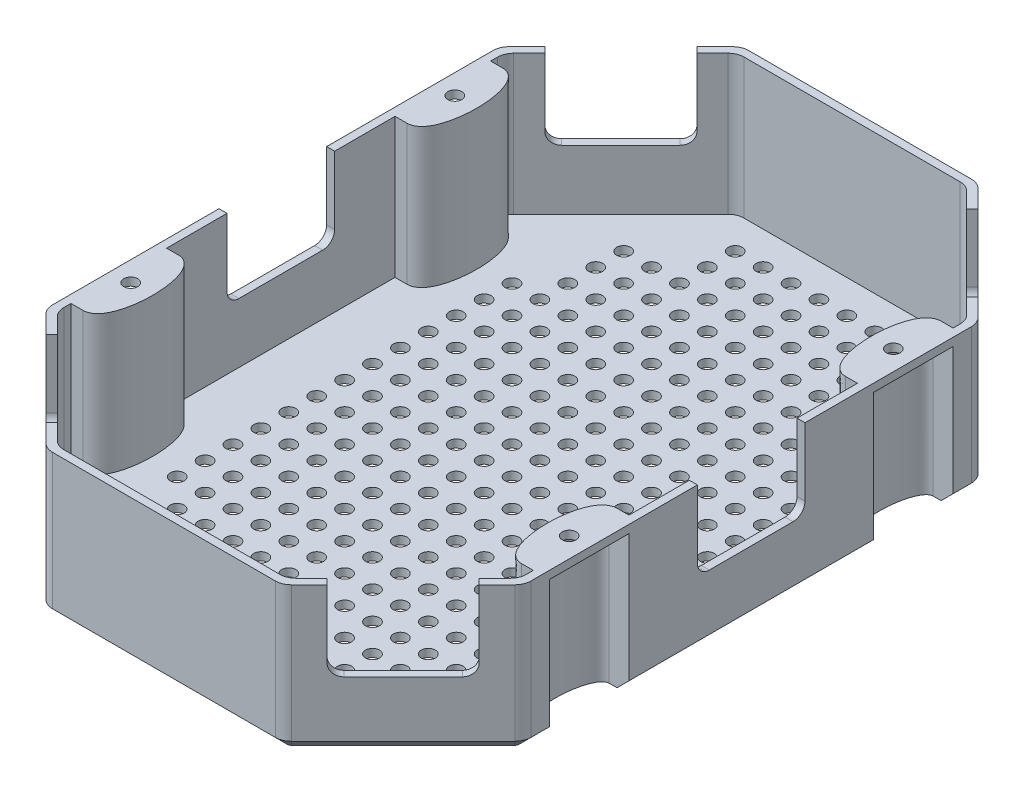
from build123d import *

# Parameters (mm, degrees)
BOSS_EXTRUDE1_DEPTH     = 2
BOSS_EXTRUDE2_DEPTH     = 35
BOSS_EXTRUDE3_DEPTH     = 2
SKETCH4_R               = 1.75
CUT_EXTRUDE1_DEPTH      = 112.570767392
SKETCH5_W               = 2
SKETCH5_H               = 27
CUT_EXTRUDE2_DEPTH      = 20
FILLET1_R               = 3
FILLET2_R               = 4
CHAMFER1_SIZE           = 3
FILL_PATTERN1_OUTLINE_R = 1.75
FILL_PATTERN1_DEPTH     = 2


# Read off the part's stored shape, not the designer's step: Fill Pattern1
with BuildPart() as part:
    # Sketch1 → Boss-Extrude1 (new body)
    with BuildSketch(Plane(origin=(0, 0, 0), x_dir=(1, 0, 0), z_dir=(0, 1, 0))):
        with BuildLine():
            Line((55, 30.651951673), (60, 30.651951673))
            Line((60, 30.651951673), (60, -30.651951673))
            Line((60, -30.651951673), (55, -30.651951673))
            add(Edge.make_bspline(
                [(55, -30.651951673), (51.5, -30.651951673), (51.5, -40.651951673), (51.5, -50.651951673), (55, -50.651951673)],
                knots=[3.141592654, 3.141592654, 3.141592654, 4.71238898, 4.71238898, 6.283185307, 6.283185307, 6.283185307], degree=2, weights=[1, 0.707106781, 1, 0.707106781, 1]))
            Line((55, -50.651951673), (60, -50.651951673))
            Line((60, -50.651951673), (60, -56.904408409))
            Line((60, -56.904408409), (29.594408409, -87.31))
            Line((29.594408409, -87.31), (0, -87.31))
            Line((0, -87.31), (0, 87.31))
            Line((0, 87.31), (29.594408409, 87.31))
            Line((29.594408409, 87.31), (60, 56.904408409))
            Line((60, 56.904408409), (60, 50.651951673))
            Line((60, 50.651951673), (55, 50.651951673))
            add(Edge.make_bspline(
                [(55, 50.651951673), (51.5, 50.651951673), (51.5, 40.651951673), (51.5, 30.651951673), (55, 30.651951673)],
                knots=[0, 0, 0, 1.570796327, 1.570796327, 3.141592654, 3.141592654, 3.141592654], degree=2, weights=[1, 0.707106781, 1, 0.707106781, 1]))
        make_face()
    extrude(amount=BOSS_EXTRUDE1_DEPTH)

    # Sketch2 → Boss-Extrude2 (add)
    with BuildSketch(Plane(origin=(0, 2, 0), x_dir=(1, 0, 0), z_dir=(0, 1, 0))):
        with BuildLine():
            Line((29.594408409, 87.31), (0, 87.31))
            Line((0, 87.31), (0, 85.31))
            Line((0, 85.31), (28.765981284, 85.31))
            Line((28.765981284, 85.31), (58, 56.075981284))
            Line((58, 56.075981284), (58, 52.651951673))
            Line((58, 52.651951673), (55, 52.651951673))
            add(Edge.make_bspline(
                [(55, 28.651951673), (54.70222525, 28.651951673), (54.094873807, 28.739043927), (53.042573201, 29.199915612), (52.077202892, 30.084886092), (51.253226578, 31.371465347), (50.612948374, 32.884681085), (50.119437244, 34.610908381), (49.645142322, 37.151780185), (49.403238452, 40.651951673), (49.645142322, 44.152123161), (50.119437244, 46.692994964), (50.612948374, 48.419222261), (51.253226578, 49.932437998), (52.077202892, 51.219017254), (53.042573201, 52.103987733), (54.094873807, 52.564859419), (54.70222525, 52.651951673), (55, 52.651951673)],
                knots=[0, 0, 0, 0, 0.09817477, 0.196349541, 0.392699082, 0.589048623, 0.785398163, 0.981747704, 1.178097245, 1.570796327, 1.963495408, 2.159844949, 2.35619449, 2.552544031, 2.748893572, 2.945243113, 3.043417883, 3.141592654, 3.141592654, 3.141592654, 3.141592654], degree=3))
            Line((55, 28.651951673), (58, 28.651951673))
            Line((58, 28.651951673), (58, -28.651951673))
            Line((58, -28.651951673), (55, -28.651951673))
            add(Edge.make_bspline(
                [(55, -52.651951673), (54.70222525, -52.651951673), (54.094873807, -52.564859419), (53.042573201, -52.103987733), (52.077202892, -51.219017254), (51.253226578, -49.932437998), (50.612948374, -48.419222261), (50.119437244, -46.692994964), (49.645142322, -44.152123161), (49.403238452, -40.651951673), (49.645142322, -37.151780185), (50.119437244, -34.610908381), (50.612948374, -32.884681085), (51.253226578, -31.371465347), (52.077202892, -30.084886092), (53.042573201, -29.199915612), (54.094873807, -28.739043927), (54.70222525, -28.651951673), (55, -28.651951673)],
                knots=[3.141592654, 3.141592654, 3.141592654, 3.141592654, 3.239767424, 3.337942194, 3.534291735, 3.730641276, 3.926990817, 4.123340358, 4.319689899, 4.71238898, 5.105088062, 5.301437603, 5.497787144, 5.694136685, 5.890486225, 6.086835766, 6.185010537, 6.283185307, 6.283185307, 6.283185307, 6.283185307], degree=3))
            Line((55, -52.651951673), (58, -52.651951673))
            Line((58, -52.651951673), (58, -56.075981284))
            Line((58, -56.075981284), (28.765981284, -85.31))
            Line((28.765981284, -85.31), (0, -85.31))
            Line((0, -85.31), (0, -87.31))
            Line((0, -87.31), (29.594408409, -87.31))
            Line((29.594408409, -87.31), (60, -56.904408409))
            Line((60, -56.904408409), (60, -50.651951673))
            Line((60, -50.651951673), (55, -50.651951673))
            add(Edge.make_bspline(
                [(55, -30.651951673), (51.5, -30.651951673), (51.5, -40.651951673), (51.5, -50.651951673), (55, -50.651951673)],
                knots=[3.141592654, 3.141592654, 3.141592654, 4.71238898, 4.71238898, 6.283185307, 6.283185307, 6.283185307], degree=2, weights=[1, 0.707106781, 1, 0.707106781, 1]))
            Line((55, -30.651951673), (60, -30.651951673))
            Line((60, -30.651951673), (60, 30.651951673))
            Line((60, 30.651951673), (55, 30.651951673))
            add(Edge.make_bspline(
                [(55, 50.651951673), (51.5, 50.651951673), (51.5, 40.651951673), (51.5, 30.651951673), (55, 30.651951673)],
                knots=[0, 0, 0, 1.570796327, 1.570796327, 3.141592654, 3.141592654, 3.141592654], degree=2, weights=[1, 0.707106781, 1, 0.707106781, 1]))
            Line((55, 50.651951673), (60, 50.651951673))
            Line((60, 50.651951673), (60, 56.904408409))
            Line((60, 56.904408409), (29.594408409, 87.31))
        make_face()
    extrude(amount=BOSS_EXTRUDE2_DEPTH)

    # Sketch3 → Boss-Extrude3 (add)
    with BuildSketch(Plane(origin=(0, 37, 0), x_dir=(1, 0, 0), z_dir=(0, 1, 0))):
        with BuildLine():
            Line((60, 30.651951673), (55, 30.651951673))
            add(Edge.make_bspline(
                [(55, 50.651951673), (51.5, 50.651951673), (51.5, 40.651951673), (51.5, 30.651951673), (55, 30.651951673)],
                knots=[0, 0, 0, 1.570796327, 1.570796327, 3.141592654, 3.141592654, 3.141592654], degree=2, weights=[1, 0.707106781, 1, 0.707106781, 1]))
            Line((55, 50.651951673), (60, 50.651951673))
            Line((60, 50.651951673), (60, 30.651951673))
        make_face()
        with BuildLine():
            Line((55, -50.651951673), (60, -50.651951673))
            Line((60, -50.651951673), (60, -30.651951673))
            Line((60, -30.651951673), (55, -30.651951673))
            add(Edge.make_bspline(
                [(55, -30.651951673), (51.5, -30.651951673), (51.5, -40.651951673), (51.5, -50.651951673), (55, -50.651951673)],
                knots=[3.141592654, 3.141592654, 3.141592654, 4.71238898, 4.71238898, 6.283185307, 6.283185307, 6.283185307], degree=2, weights=[1, 0.707106781, 1, 0.707106781, 1]))
        make_face()
    extrude(amount=-BOSS_EXTRUDE3_DEPTH)

    # Sketch4 → Cut-Extrude1 (cut, through all)
    with BuildSketch(Plane.XZ.offset(-35)):
        with Locations(Location((55, 40.651951673, 0), (0, 0, 270))):
            Circle(SKETCH4_R)
        with Locations(Location((55, -40.651951673, 0), (0, 0, 90))):
            Circle(SKETCH4_R)
    extrude(amount=-CUT_EXTRUDE1_DEPTH, mode=Mode.SUBTRACT)

    # Sketch5 → Cut-Extrude2 (cut)
    with BuildSketch(Plane(origin=(0, 37, 0), x_dir=(1, 0, 0), z_dir=(0, 1, 0))):
        with Locations((59, 0)):
            Rectangle(SKETCH5_W, SKETCH5_H)
        Polygon((33.837049096, 80.238932188), (52.928932188, 61.147049096), (54.343145751, 62.561262658), (35.251262658, 81.653145751), align=None)
        Polygon((54.343145751, -62.561262658), (35.251262658, -81.653145751), (33.837049096, -80.238932188), (52.928932188, -61.147049096), align=None)
    extrude(amount=-CUT_EXTRUDE2_DEPTH, mode=Mode.SUBTRACT)

    # Fillet1
    fillet1_edges = [part.edges().sort_by_distance(p)[0] for p in [
        (59, 17, -13.5),
        (59, 17, 13.5),
        (53.636038969, 17, -61.854155877),
        (34.544155877, 17, -80.946038969),
        (53.636038969, 17, 61.854155877),
        (34.544155877, 17, 80.946038969),
    ]]
    fillet(fillet1_edges, radius=FILLET1_R)

    # Fillet2
    fillet2_edges = [part.edges().sort_by_distance(p)[0] for p in [
        (60, 18.5, 56.904408409),
        (29.594408409, 18.5, 87.31),
        (29.594408409, 18.5, -87.31),
        (60, 18.5, -56.904408409),
        (28.765981284, 19.5, -85.31),
        (58, 19.5, -56.075981284),
        (58, 19.5, 56.075981284),
        (28.765981284, 19.5, 85.31),
    ]]
    fillet(fillet2_edges, radius=FILLET2_R)

    # Chamfer1
    chamfer1_edges = [part.edges().sort_by_distance(p)[0] for p in [
        (60, 0, 0),
        (13.96877708, 0, 87.31),
        (60, 0, -52.949752916),
        (13.96877708, 0, -87.31),
        (60, 0, 52.949752916),
        (44.797204204, 0, 72.107204204),
        (44.797204204, 0, -72.107204204),
        (29.468287889, 0, 87.00551813),
        (59.69551813, 0, 56.778287889),
        (59.69551813, 0, -56.778287889),
        (29.468287889, 0, -87.00551813),
    ]]
    chamfer(chamfer1_edges, length=CHAMFER1_SIZE)

    # Mirror1: part across plane


with BuildPart() as part_1:
    add(part.part)
    add(part.part.mirror(Plane(origin=(0, 0, 0), x_dir=(0, 0, 1), z_dir=(1, 0, 0))))

    # Fill Pattern1 outline → Fill Pattern1 (cut)
    with BuildSketch(Plane(origin=(0, 0, 0), x_dir=(1, 0, 0), z_dir=(0, 1, 0))):
        Circle(FILL_PATTERN1_OUTLINE_R)
        with Locations((21, -77)):
            Circle(FILL_PATTERN1_OUTLINE_R)
        with Locations((14, -77)):
            Circle(FILL_PATTERN1_OUTLINE_R)
        with Locations((7, -77)):
            Circle(FILL_PATTERN1_OUTLINE_R)
        with Locations((0, -77)):
            Circle(FILL_PATTERN1_OUTLINE_R)
        with Locations((-7, -77)):
            Circle(FILL_PATTERN1_OUTLINE_R)
        with Locations((-14, -77)):
            Circle(FILL_PATTERN1_OUTLINE_R)
        with Locations((-7, 56)):
            Circle(FILL_PATTERN1_OUTLINE_R)
        with Locations((0, 63)):
            Circle(FILL_PATTERN1_OUTLINE_R)
        with Locations((7, 70)):
            Circle(FILL_PATTERN1_OUTLINE_R)
        with Locations((14, 77)):
            Circle(FILL_PATTERN1_OUTLINE_R)
        with Locations((0, -14)):
            Circle(FILL_PATTERN1_OUTLINE_R)
        with Locations((-21, -7)):
            Circle(FILL_PATTERN1_OUTLINE_R)
        with Locations((-28, 14)):
            Circle(FILL_PATTERN1_OUTLINE_R)
        with Locations((-35, 35)):
            Circle(FILL_PATTERN1_OUTLINE_R)
        with Locations((-21, -14)):
            Circle(FILL_PATTERN1_OUTLINE_R)
        with Locations((7, -14)):
            Circle(FILL_PATTERN1_OUTLINE_R)
        with Locations((7, 77)):
            Circle(FILL_PATTERN1_OUTLINE_R)
        with Locations((0, 70)):
            Circle(FILL_PATTERN1_OUTLINE_R)
        with Locations((-7, 63)):
            Circle(FILL_PATTERN1_OUTLINE_R)
        with Locations((-14, 56)):
            Circle(FILL_PATTERN1_OUTLINE_R)
        with Locations((-21, 49)):
            Circle(FILL_PATTERN1_OUTLINE_R)
        with Locations((-28, 42)):
            Circle(FILL_PATTERN1_OUTLINE_R)
        with Locations((-14, -14)):
            Circle(FILL_PATTERN1_OUTLINE_R)
        with Locations((-21, 7)):
            Circle(FILL_PATTERN1_OUTLINE_R)
        with Locations((-28, 28)):
            Circle(FILL_PATTERN1_OUTLINE_R)
        with Locations((-21, 35)):
            Circle(FILL_PATTERN1_OUTLINE_R)
        with Locations((-14, 42)):
            Circle(FILL_PATTERN1_OUTLINE_R)
        with Locations((-7, 49)):
            Circle(FILL_PATTERN1_OUTLINE_R)
        with Locations((0, 56)):
            Circle(FILL_PATTERN1_OUTLINE_R)
        with Locations((7, 63)):
            Circle(FILL_PATTERN1_OUTLINE_R)
        with Locations((-14, 49)):
            Circle(FILL_PATTERN1_OUTLINE_R)
        with Locations((-21, 42)):
            Circle(FILL_PATTERN1_OUTLINE_R)
        with Locations((-28, 35)):
            Circle(FILL_PATTERN1_OUTLINE_R)
        with Locations((-28, 21)):
            Circle(FILL_PATTERN1_OUTLINE_R)
        with Locations((-21, 0)):
            Circle(FILL_PATTERN1_OUTLINE_R)
        with Locations((-7, -14)):
            Circle(FILL_PATTERN1_OUTLINE_R)
        with Locations((21, 77)):
            Circle(FILL_PATTERN1_OUTLINE_R)
        with Locations((14, 70)):
            Circle(FILL_PATTERN1_OUTLINE_R)
        with Locations((-14, 70)):
            Circle(FILL_PATTERN1_OUTLINE_R)
        with Locations((-7, 77)):
            Circle(FILL_PATTERN1_OUTLINE_R)
        with Locations((14, -7)):
            Circle(FILL_PATTERN1_OUTLINE_R)
        with Locations((-14, -21)):
            Circle(FILL_PATTERN1_OUTLINE_R)
        with Locations((-28, -7)):
            Circle(FILL_PATTERN1_OUTLINE_R)
        with Locations((-35, 14)):
            Circle(FILL_PATTERN1_OUTLINE_R)
        with Locations((-42, 35)):
            Circle(FILL_PATTERN1_OUTLINE_R)
        with Locations((-35, 56)):
            Circle(FILL_PATTERN1_OUTLINE_R)
        with Locations((-42, 28)):
            Circle(FILL_PATTERN1_OUTLINE_R)
        with Locations((-35, 7)):
            Circle(FILL_PATTERN1_OUTLINE_R)
        with Locations((-28, -14)):
            Circle(FILL_PATTERN1_OUTLINE_R)
        with Locations((-7, -21)):
            Circle(FILL_PATTERN1_OUTLINE_R)
        with Locations((14, 0)):
            Circle(FILL_PATTERN1_OUTLINE_R)
        with Locations((-14, 77)):
            Circle(FILL_PATTERN1_OUTLINE_R)
        with Locations((-21, 70)):
            Circle(FILL_PATTERN1_OUTLINE_R)
        with Locations((-28, 63)):
            Circle(FILL_PATTERN1_OUTLINE_R)
        with Locations((-28, 7)):
            Circle(FILL_PATTERN1_OUTLINE_R)
        with Locations((-35, 28)):
            Circle(FILL_PATTERN1_OUTLINE_R)
        with Locations((-35, 42)):
            Circle(FILL_PATTERN1_OUTLINE_R)
        with Locations((-28, 49)):
            Circle(FILL_PATTERN1_OUTLINE_R)
        with Locations((-21, 56)):
            Circle(FILL_PATTERN1_OUTLINE_R)
        with Locations((-14, 63)):
            Circle(FILL_PATTERN1_OUTLINE_R)
        with Locations((-7, 70)):
            Circle(FILL_PATTERN1_OUTLINE_R)
        with Locations((0, 77)):
            Circle(FILL_PATTERN1_OUTLINE_R)
        with Locations((14, -14)):
            Circle(FILL_PATTERN1_OUTLINE_R)
        with Locations((-21, -21)):
            Circle(FILL_PATTERN1_OUTLINE_R)
        with Locations((-28, 0)):
            Circle(FILL_PATTERN1_OUTLINE_R)
        with Locations((-35, 21)):
            Circle(FILL_PATTERN1_OUTLINE_R)
        with Locations((-42, 42)):
            Circle(FILL_PATTERN1_OUTLINE_R)
        with Locations((-35, 49)):
            Circle(FILL_PATTERN1_OUTLINE_R)
        with Locations((-28, 56)):
            Circle(FILL_PATTERN1_OUTLINE_R)
        with Locations((-21, 63)):
            Circle(FILL_PATTERN1_OUTLINE_R)
        with Locations((14, 35)):
            Circle(FILL_PATTERN1_OUTLINE_R)
        with Locations((7, 28)):
            Circle(FILL_PATTERN1_OUTLINE_R)
        with Locations((0, 21)):
            Circle(FILL_PATTERN1_OUTLINE_R)
        with Locations((-7, 14)):
            Circle(FILL_PATTERN1_OUTLINE_R)
        with Locations((21, 35)):
            Circle(FILL_PATTERN1_OUTLINE_R)
        with Locations((28, 42)):
            Circle(FILL_PATTERN1_OUTLINE_R)
        with Locations((35, 49)):
            Circle(FILL_PATTERN1_OUTLINE_R)
        with Locations((-7, 0)):
            Circle(FILL_PATTERN1_OUTLINE_R)
        with Locations((7, 35)):
            Circle(FILL_PATTERN1_OUTLINE_R)
        with Locations((0, 28)):
            Circle(FILL_PATTERN1_OUTLINE_R)
        with Locations((-7, 21)):
            Circle(FILL_PATTERN1_OUTLINE_R)
        with Locations((-14, 14)):
            Circle(FILL_PATTERN1_OUTLINE_R)
        with Locations((21, 42)):
            Circle(FILL_PATTERN1_OUTLINE_R)
        with Locations((28, 49)):
            Circle(FILL_PATTERN1_OUTLINE_R)
        with Locations((35, 56)):
            Circle(FILL_PATTERN1_OUTLINE_R)
        with Locations((-7, -7)):
            Circle(FILL_PATTERN1_OUTLINE_R)
        with Locations((7, 14)):
            Circle(FILL_PATTERN1_OUTLINE_R)
        with Locations((0, 7)):
            Circle(FILL_PATTERN1_OUTLINE_R)
        with Locations((42, 42)):
            Circle(FILL_PATTERN1_OUTLINE_R)
        with Locations((35, 35)):
            Circle(FILL_PATTERN1_OUTLINE_R)
        with Locations((28, 28)):
            Circle(FILL_PATTERN1_OUTLINE_R)
        with Locations((21, 21)):
            Circle(FILL_PATTERN1_OUTLINE_R)
        with Locations((14, 14)):
            Circle(FILL_PATTERN1_OUTLINE_R)
        with Locations((7, 7)):
            Circle(FILL_PATTERN1_OUTLINE_R)
        with Locations((14, 28)):
            Circle(FILL_PATTERN1_OUTLINE_R)
        with Locations((7, 21)):
            Circle(FILL_PATTERN1_OUTLINE_R)
        with Locations((0, 14)):
            Circle(FILL_PATTERN1_OUTLINE_R)
        with Locations((-7, 7)):
            Circle(FILL_PATTERN1_OUTLINE_R)
        with Locations((35, 42)):
            Circle(FILL_PATTERN1_OUTLINE_R)
        with Locations((28, 35)):
            Circle(FILL_PATTERN1_OUTLINE_R)
        with Locations((21, 28)):
            Circle(FILL_PATTERN1_OUTLINE_R)
        with Locations((14, 21)):
            Circle(FILL_PATTERN1_OUTLINE_R)
        with Locations((-14, -7)):
            Circle(FILL_PATTERN1_OUTLINE_R)
        with Locations((7, 0)):
            Circle(FILL_PATTERN1_OUTLINE_R)
        with Locations((21, 63)):
            Circle(FILL_PATTERN1_OUTLINE_R)
        with Locations((14, 56)):
            Circle(FILL_PATTERN1_OUTLINE_R)
        with Locations((7, 49)):
            Circle(FILL_PATTERN1_OUTLINE_R)
        with Locations((0, 42)):
            Circle(FILL_PATTERN1_OUTLINE_R)
        with Locations((-7, 35)):
            Circle(FILL_PATTERN1_OUTLINE_R)
        with Locations((-14, 28)):
            Circle(FILL_PATTERN1_OUTLINE_R)
        with Locations((-21, 14)):
            Circle(FILL_PATTERN1_OUTLINE_R)
        with Locations((-21, 28)):
            Circle(FILL_PATTERN1_OUTLINE_R)
        with Locations((-14, 35)):
            Circle(FILL_PATTERN1_OUTLINE_R)
        with Locations((-7, 42)):
            Circle(FILL_PATTERN1_OUTLINE_R)
        with Locations((0, 49)):
            Circle(FILL_PATTERN1_OUTLINE_R)
        with Locations((7, 56)):
            Circle(FILL_PATTERN1_OUTLINE_R)
        with Locations((14, 63)):
            Circle(FILL_PATTERN1_OUTLINE_R)
        with Locations((21, 70)):
            Circle(FILL_PATTERN1_OUTLINE_R)
        with Locations((14, 42)):
            Circle(FILL_PATTERN1_OUTLINE_R)
        with Locations((21, 49)):
            Circle(FILL_PATTERN1_OUTLINE_R)
        with Locations((28, 56)):
            Circle(FILL_PATTERN1_OUTLINE_R)
        with Locations((35, 63)):
            Circle(FILL_PATTERN1_OUTLINE_R)
        with Locations((0, -7)):
            Circle(FILL_PATTERN1_OUTLINE_R)
        with Locations((-14, 7)):
            Circle(FILL_PATTERN1_OUTLINE_R)
        with Locations((-14, 21)):
            Circle(FILL_PATTERN1_OUTLINE_R)
        with Locations((-7, 28)):
            Circle(FILL_PATTERN1_OUTLINE_R)
        with Locations((-21, 21)):
            Circle(FILL_PATTERN1_OUTLINE_R)
        with Locations((-14, 0)):
            Circle(FILL_PATTERN1_OUTLINE_R)
        with Locations((7, -7)):
            Circle(FILL_PATTERN1_OUTLINE_R)
        with Locations((28, 63)):
            Circle(FILL_PATTERN1_OUTLINE_R)
        with Locations((21, 56)):
            Circle(FILL_PATTERN1_OUTLINE_R)
        with Locations((14, 49)):
            Circle(FILL_PATTERN1_OUTLINE_R)
        with Locations((7, 42)):
            Circle(FILL_PATTERN1_OUTLINE_R)
        with Locations((0, 35)):
            Circle(FILL_PATTERN1_OUTLINE_R)
        with Locations((42, -28)):
            Circle(FILL_PATTERN1_OUTLINE_R)
        with Locations((35, 21)):
            Circle(FILL_PATTERN1_OUTLINE_R)
        with Locations((-21, -56)):
            Circle(FILL_PATTERN1_OUTLINE_R)
        with Locations((14, -49)):
            Circle(FILL_PATTERN1_OUTLINE_R)
        with Locations((42, -35)):
            Circle(FILL_PATTERN1_OUTLINE_R)
        with Locations((35, 14)):
            Circle(FILL_PATTERN1_OUTLINE_R)
        with Locations((-28, -56)):
            Circle(FILL_PATTERN1_OUTLINE_R)
        with Locations((7, -49)):
            Circle(FILL_PATTERN1_OUTLINE_R)
        with Locations((35, -49)):
            Circle(FILL_PATTERN1_OUTLINE_R)
        with Locations((42, -14)):
            Circle(FILL_PATTERN1_OUTLINE_R)
        with Locations((-7, -56)):
            Circle(FILL_PATTERN1_OUTLINE_R)
        with Locations((28, -49)):
            Circle(FILL_PATTERN1_OUTLINE_R)
        with Locations((42, -21)):
            Circle(FILL_PATTERN1_OUTLINE_R)
        with Locations((35, 28)):
            Circle(FILL_PATTERN1_OUTLINE_R)
        with Locations((-14, -56)):
            Circle(FILL_PATTERN1_OUTLINE_R)
        with Locations((21, -49)):
            Circle(FILL_PATTERN1_OUTLINE_R)
        with Locations((35, -14)):
            Circle(FILL_PATTERN1_OUTLINE_R)
        with Locations((21, -42)):
            Circle(FILL_PATTERN1_OUTLINE_R)
        with Locations((-14, -49)):
            Circle(FILL_PATTERN1_OUTLINE_R)
        with Locations((35, -7)):
            Circle(FILL_PATTERN1_OUTLINE_R)
        with Locations((-28, -49)):
            Circle(FILL_PATTERN1_OUTLINE_R)
        with Locations((35, -21)):
            Circle(FILL_PATTERN1_OUTLINE_R)
        with Locations((14, -42)):
            Circle(FILL_PATTERN1_OUTLINE_R)
        with Locations((-21, -49)):
            Circle(FILL_PATTERN1_OUTLINE_R)
        with Locations((42, -42)):
            Circle(FILL_PATTERN1_OUTLINE_R)
        with Locations((35, 7)):
            Circle(FILL_PATTERN1_OUTLINE_R)
        with Locations((-35, -56)):
            Circle(FILL_PATTERN1_OUTLINE_R)
        with Locations((0, -49)):
            Circle(FILL_PATTERN1_OUTLINE_R)
        with Locations((35, -42)):
            Circle(FILL_PATTERN1_OUTLINE_R)
        with Locations((35, 0)):
            Circle(FILL_PATTERN1_OUTLINE_R)
        with Locations((-7, -49)):
            Circle(FILL_PATTERN1_OUTLINE_R)
        with Locations((28, -42)):
            Circle(FILL_PATTERN1_OUTLINE_R)
        with Locations((14, -63)):
            Circle(FILL_PATTERN1_OUTLINE_R)
        with Locations((-21, -70)):
            Circle(FILL_PATTERN1_OUTLINE_R)
        with Locations((21, -63)):
            Circle(FILL_PATTERN1_OUTLINE_R)
        with Locations((-14, -70)):
            Circle(FILL_PATTERN1_OUTLINE_R)
        with Locations((0, -63)):
            Circle(FILL_PATTERN1_OUTLINE_R)
        with Locations((42, 28)):
            Circle(FILL_PATTERN1_OUTLINE_R)
        with Locations((7, -63)):
            Circle(FILL_PATTERN1_OUTLINE_R)
        with Locations((42, 35)):
            Circle(FILL_PATTERN1_OUTLINE_R)
        with Locations((7, -70)):
            Circle(FILL_PATTERN1_OUTLINE_R)
        with Locations((14, -70)):
            Circle(FILL_PATTERN1_OUTLINE_R)
        with Locations((-21, -77)):
            Circle(FILL_PATTERN1_OUTLINE_R)
        with Locations((21, -70)):
            Circle(FILL_PATTERN1_OUTLINE_R)
        with Locations((28, -63)):
            Circle(FILL_PATTERN1_OUTLINE_R)
        with Locations((-7, -70)):
            Circle(FILL_PATTERN1_OUTLINE_R)
        with Locations((35, -63)):
            Circle(FILL_PATTERN1_OUTLINE_R)
        with Locations((0, -70)):
            Circle(FILL_PATTERN1_OUTLINE_R)
        with Locations((-28, -63)):
            Circle(FILL_PATTERN1_OUTLINE_R)
        with Locations((42, 0)):
            Circle(FILL_PATTERN1_OUTLINE_R)
        with Locations((14, -56)):
            Circle(FILL_PATTERN1_OUTLINE_R)
        with Locations((-21, -63)):
            Circle(FILL_PATTERN1_OUTLINE_R)
        with Locations((7, -56)):
            Circle(FILL_PATTERN1_OUTLINE_R)
        with Locations((42, -7)):
            Circle(FILL_PATTERN1_OUTLINE_R)
        with Locations((-35, -63)):
            Circle(FILL_PATTERN1_OUTLINE_R)
        with Locations((0, -56)):
            Circle(FILL_PATTERN1_OUTLINE_R)
        with Locations((35, -56)):
            Circle(FILL_PATTERN1_OUTLINE_R)
        with Locations((42, 21)):
            Circle(FILL_PATTERN1_OUTLINE_R)
        with Locations((-7, -63)):
            Circle(FILL_PATTERN1_OUTLINE_R)
        with Locations((28, -56)):
            Circle(FILL_PATTERN1_OUTLINE_R)
        with Locations((42, 7)):
            Circle(FILL_PATTERN1_OUTLINE_R)
        with Locations((21, -56)):
            Circle(FILL_PATTERN1_OUTLINE_R)
        with Locations((-14, -63)):
            Circle(FILL_PATTERN1_OUTLINE_R)
        with Locations((42, 14)):
            Circle(FILL_PATTERN1_OUTLINE_R)
        with Locations((21, -7)):
            Circle(FILL_PATTERN1_OUTLINE_R)
        with Locations((-42, -7)):
            Circle(FILL_PATTERN1_OUTLINE_R)
        with Locations((-35, -28)):
            Circle(FILL_PATTERN1_OUTLINE_R)
        with Locations((-7, -28)):
            Circle(FILL_PATTERN1_OUTLINE_R)
        with Locations((21, -14)):
            Circle(FILL_PATTERN1_OUTLINE_R)
        with Locations((-42, 0)):
            Circle(FILL_PATTERN1_OUTLINE_R)
        with Locations((-35, -21)):
            Circle(FILL_PATTERN1_OUTLINE_R)
        with Locations((-14, -28)):
            Circle(FILL_PATTERN1_OUTLINE_R)
        with Locations((21, 7)):
            Circle(FILL_PATTERN1_OUTLINE_R)
        with Locations((-42, -21)):
            Circle(FILL_PATTERN1_OUTLINE_R)
        with Locations((-28, -35)):
            Circle(FILL_PATTERN1_OUTLINE_R)
        with Locations((7, -28)):
            Circle(FILL_PATTERN1_OUTLINE_R)
        with Locations((21, 0)):
            Circle(FILL_PATTERN1_OUTLINE_R)
        with Locations((-42, -14)):
            Circle(FILL_PATTERN1_OUTLINE_R)
        with Locations((-35, -35)):
            Circle(FILL_PATTERN1_OUTLINE_R)
        with Locations((0, -28)):
            Circle(FILL_PATTERN1_OUTLINE_R)
        with Locations((-28, -21)):
            Circle(FILL_PATTERN1_OUTLINE_R)
        with Locations((-35, 0)):
            Circle(FILL_PATTERN1_OUTLINE_R)
        with Locations((-42, 21)):
            Circle(FILL_PATTERN1_OUTLINE_R)
        with Locations((7, -21)):
            Circle(FILL_PATTERN1_OUTLINE_R)
        with Locations((0, -21)):
            Circle(FILL_PATTERN1_OUTLINE_R)
        with Locations((14, 7)):
            Circle(FILL_PATTERN1_OUTLINE_R)
        with Locations((-21, 77)):
            Circle(FILL_PATTERN1_OUTLINE_R)
        with Locations((-35, 63)):
            Circle(FILL_PATTERN1_OUTLINE_R)
        with Locations((-21, -28)):
            Circle(FILL_PATTERN1_OUTLINE_R)
        with Locations((-35, -14)):
            Circle(FILL_PATTERN1_OUTLINE_R)
        with Locations((-42, 7)):
            Circle(FILL_PATTERN1_OUTLINE_R)
        with Locations((21, -21)):
            Circle(FILL_PATTERN1_OUTLINE_R)
        with Locations((-28, -28)):
            Circle(FILL_PATTERN1_OUTLINE_R)
        with Locations((-35, -7)):
            Circle(FILL_PATTERN1_OUTLINE_R)
        with Locations((-42, 14)):
            Circle(FILL_PATTERN1_OUTLINE_R)
        with Locations((14, -21)):
            Circle(FILL_PATTERN1_OUTLINE_R)
        with Locations((28, -35)):
            Circle(FILL_PATTERN1_OUTLINE_R)
        with Locations((28, 7)):
            Circle(FILL_PATTERN1_OUTLINE_R)
        with Locations((-14, -42)):
            Circle(FILL_PATTERN1_OUTLINE_R)
        with Locations((21, -35)):
            Circle(FILL_PATTERN1_OUTLINE_R)
        with Locations((28, -7)):
            Circle(FILL_PATTERN1_OUTLINE_R)
        with Locations((14, -35)):
            Circle(FILL_PATTERN1_OUTLINE_R)
        with Locations((-21, -42)):
            Circle(FILL_PATTERN1_OUTLINE_R)
        with Locations((28, 0)):
            Circle(FILL_PATTERN1_OUTLINE_R)
        with Locations((-35, -49)):
            Circle(FILL_PATTERN1_OUTLINE_R)
        with Locations((28, 21)):
            Circle(FILL_PATTERN1_OUTLINE_R)
        with Locations((35, -28)):
            Circle(FILL_PATTERN1_OUTLINE_R)
        with Locations((7, -42)):
            Circle(FILL_PATTERN1_OUTLINE_R)
        with Locations((-7, -42)):
            Circle(FILL_PATTERN1_OUTLINE_R)
        with Locations((28, 14)):
            Circle(FILL_PATTERN1_OUTLINE_R)
        with Locations((35, -35)):
            Circle(FILL_PATTERN1_OUTLINE_R)
        with Locations((0, -42)):
            Circle(FILL_PATTERN1_OUTLINE_R)
        with Locations((21, -28)):
            Circle(FILL_PATTERN1_OUTLINE_R)
        with Locations((-14, -35)):
            Circle(FILL_PATTERN1_OUTLINE_R)
        with Locations((-42, -35)):
            Circle(FILL_PATTERN1_OUTLINE_R)
        with Locations((28, -28)):
            Circle(FILL_PATTERN1_OUTLINE_R)
        with Locations((14, -28)):
            Circle(FILL_PATTERN1_OUTLINE_R)
        with Locations((-21, -35)):
            Circle(FILL_PATTERN1_OUTLINE_R)
        with Locations((-42, -28)):
            Circle(FILL_PATTERN1_OUTLINE_R)
        with Locations((21, 14)):
            Circle(FILL_PATTERN1_OUTLINE_R)
        with Locations((-35, -42)):
            Circle(FILL_PATTERN1_OUTLINE_R)
        with Locations((28, -14)):
            Circle(FILL_PATTERN1_OUTLINE_R)
        with Locations((7, -35)):
            Circle(FILL_PATTERN1_OUTLINE_R)
        with Locations((-28, -42)):
            Circle(FILL_PATTERN1_OUTLINE_R)
        with Locations((0, -35)):
            Circle(FILL_PATTERN1_OUTLINE_R)
        with Locations((28, -21)):
            Circle(FILL_PATTERN1_OUTLINE_R)
        with Locations((-42, -42)):
            Circle(FILL_PATTERN1_OUTLINE_R)
        with Locations((-7, -35)):
            Circle(FILL_PATTERN1_OUTLINE_R)
    extrude(amount=FILL_PATTERN1_DEPTH, mode=Mode.SUBTRACT)


solid = part_1.part
